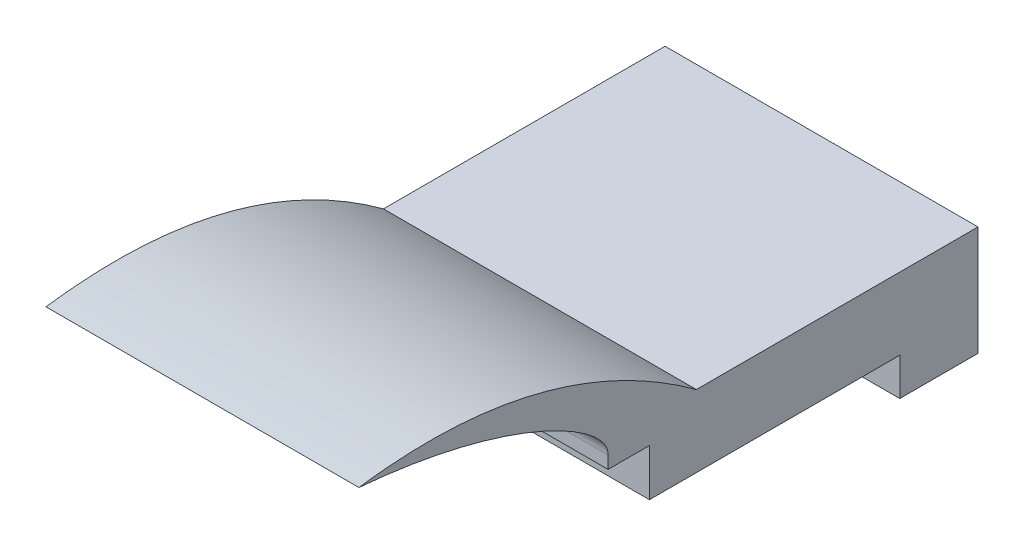
from build123d import *

# Parameters (mm, degrees)
BOSS_EXTRUDE1_DEPTH     = 63.5
CUT_EXTRUDE1_DEPTH      = 158.583904829
CUT_EXTRUDE1_DEPTH_BACK = 158.583904829
SKETCH2_R               = 3.175
BOSS_EXTRUDE2_START     = 114.3
SKETCH3_W               = 127
SKETCH3_H               = 44.45
SKETCH3_R               = 3.175
BOSS_EXTRUDE2_DEPTH     = 114.3
SKETCH4_W               = 101.6
SKETCH4_H               = 15.24
CUT_EXTRUDE2_DEPTH      = 212.025644699


with BuildPart() as part:
    # Sketch1 → Boss-Extrude1 (new, symmetric)
    with BuildSketch(Plane(origin=(0, 0, 0), x_dir=(0, 0, -1), z_dir=(1, 0, 0))):
        with BuildLine():
            Line((12.216524974, 4.064), (12.216524974, -1.016))
            Line((12.216524974, -1.016), (29.003260665, -1.016))
            Line((29.003260665, -1.016), (29.003260665, -35.306))
            Line((29.003260665, -35.306), (48.053260665, -35.306))
            Line((48.053260665, -35.306), (48.053260665, 9.144))
            add(Edge.make_bspline(
                [(-88.9, 43.18), (-12.953857156, 53.77712163), (48.053260665, 9.144)],
                knots=[0, 0, 0, 1, 1, 1], degree=2))
            add(Edge.make_bspline(
                [(-88.9, 43.18), (-83.946304604, 42.756966567), (-73.590524498, 41.621763077), (-58.309639486, 39.117791383), (-43.53982652, 35.778224897), (-30.248733188, 31.895040034), (-18.591894572, 27.64289511), (-8.694915373, 23.194301958), (-0.651693238, 18.721072423), (5.501877989, 14.381620629), (9.732718027, 10.270423674), (11.898298119, 6.809256388), (12.218439383, 4.69623549), (12.216524974, 4.064)],
                knots=[0.35379081, 0.35379081, 0.35379081, 0.35379081, 0.374279703, 0.396711254, 0.417576734, 0.436654006, 0.45374439, 0.468679994, 0.481329415, 0.491630702, 0.499615789, 0.505546281, 0.508115399, 0.508115399, 0.508115399, 0.508115399], degree=3))
        make_face()
    extrude(amount=BOSS_EXTRUDE1_DEPTH, both=True)

    # Sketch2 → Cut-Extrude1 (cut, two sides: drawn at the far end of the back side and taken through both)
    with BuildSketch(Plane(origin=(0, 0, -48.053260665), x_dir=(-1, 0, 0), z_dir=(0, 0, -1)).offset(-CUT_EXTRUDE1_DEPTH_BACK)):
        with Locations((-31.75, -11.176)):
            Circle(SKETCH2_R)
        with Locations((31.75, -11.176)):
            Circle(SKETCH2_R)
    extrude(amount=CUT_EXTRUDE1_DEPTH + CUT_EXTRUDE1_DEPTH_BACK, mode=Mode.SUBTRACT)

    # Sketch3 → Boss-Extrude2 (add)
    with BuildSketch(Plane(origin=(0, 0, -48.053260665), x_dir=(-1, 0, 0), z_dir=(0, 0, -1)).offset(BOSS_EXTRUDE2_START)):
        with Locations((0, -13.081)):
            Rectangle(SKETCH3_W, SKETCH3_H)
        with Locations((-31.75, -11.176)):
            Circle(SKETCH3_R, mode=Mode.SUBTRACT)
        with Locations((31.75, -11.176)):
            Circle(SKETCH3_R, mode=Mode.SUBTRACT)
    extrude(amount=-BOSS_EXTRUDE2_DEPTH)

    # Sketch4 → Cut-Extrude2 (cut, through all)
    with BuildSketch(Plane.ZY.offset(63.5)):
        with Locations((-79.803260665, -27.686)):
            Rectangle(SKETCH4_W, SKETCH4_H)
    extrude(amount=-CUT_EXTRUDE2_DEPTH, mode=Mode.SUBTRACT)


solid = part.part
